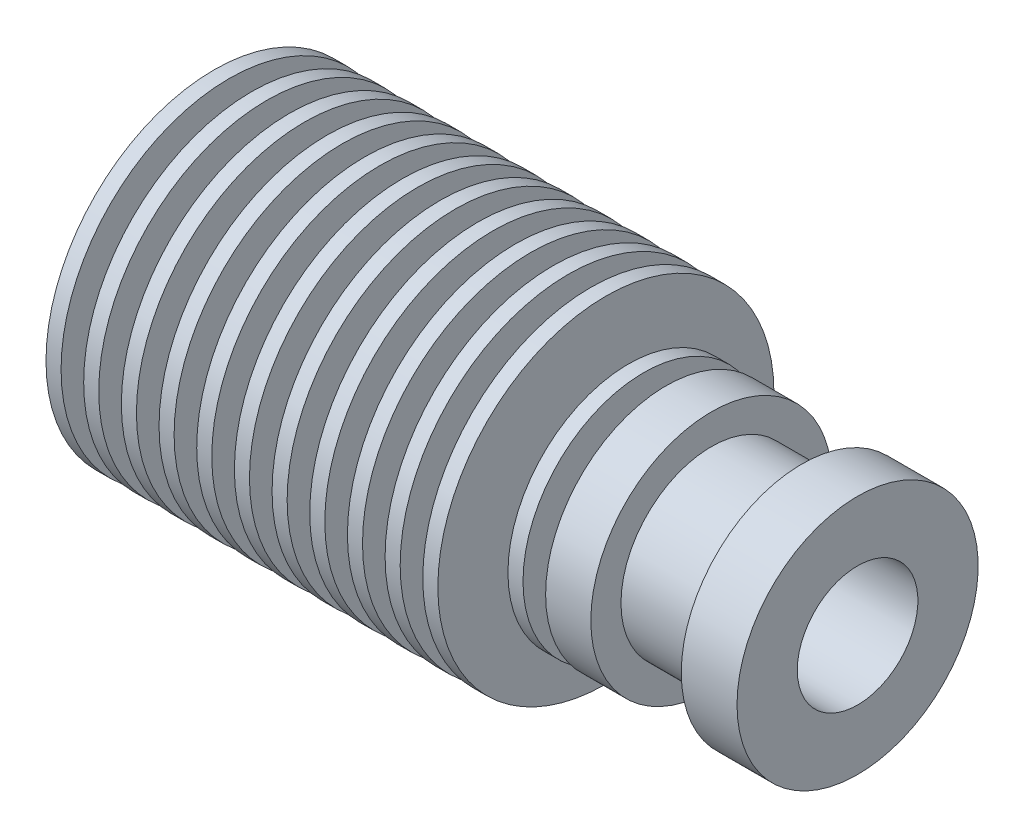
from build123d import *

# Parameters (mm, degrees)
THREAD1_PITCH = 1


with BuildPart() as part:
    # Sketch1 → Revolve1 (revolve)
    with BuildSketch(Plane.XY, mode=Mode.PRIVATE) as revolve1_sk:
        Polygon((9.7, 11.534202282), (6, 11.534202282), (6, 13.534202282), (0, 13.534202282), (0, 11.534202282), (-3, 11.534202282), (-3, 15.534202282), (-4.5, 15.457827897), (-4.5, 11.534202282), (-5.5, 11.534202282), (-5.5, 15.406911641), (-7, 15.330537257), (-7, 8.384202282), (-8, 8.384202282), (-8, 15.279621001), (-9.5, 15.203246617), (-9.5, 8.384202282), (-10.5, 8.384202282), (-10.5, 15.15233036), (-12, 15.075955976), (-12, 8.384202282), (-13, 8.384202282), (-13, 15.02503972), (-14.5, 14.948665336), (-14.5, 8.384202282), (-15.5, 8.384202282), (-15.5, 14.89774908), (-17, 14.821374695), (-17, 8.384202282), (-18, 8.384202282), (-18, 14.770458439), (-19.5, 14.694084055), (-19.5, 8.384202282), (-20.5, 8.384202282), (-20.5, 14.643167799), (-22, 14.566793415), (-22, 8.384202282), (-23, 8.384202282), (-23, 14.515877158), (-24.5, 14.439502774), (-24.5, 8.384202282), (-25.5, 8.384202282), (-25.5, 14.388586518), (-27, 14.312212134), (-27, 8.384202282), (-28, 8.384202282), (-28, 14.261295878), (-29.5, 14.184921493), (-29.5, 8.384202282), (-30.5, 8.384202282), (-30.5, 14.134005237), (-32, 14.057630853), (-32, 8.384202282), (-33, 8.384202282), (-33, 14.014202282), (-33, 16.534202282), (-17.9, 16.534202282), (-17, 17.434202282), (1.3, 17.434202282), (3.2, 15.534202282), (9.7, 15.534202282), align=None)
    revolve(revolve1_sk.sketch.rotate(Axis((-33, 19.534202282, 0), (1, 0, 0)), 270), axis=Axis((-33, 19.534202282, 0), (1, 0, 0)))

    # Thread1: the profile of Thread Profile2 profile screwed along a right-hand helix of 15.1 turns, 8 arcs to a turn; built about Z, then put on its axis
    thread1_z = Axis((0, 0, 0), (0, 0, 1))
    thread1_corners = [(2.9997, 0, -0.000173205), (3.541265875, 0, 0.312499999), (3.541265875, 0, 0.437499999), (2.9997, 0, 0.750173202)]
    with BuildLine(mode=Mode.PRIVATE) as thread1_profile:
        Line(thread1_corners[0], thread1_corners[1])
        Line(thread1_corners[1], thread1_corners[2])
        Line(thread1_corners[2], thread1_corners[3])
        Line(thread1_corners[3], thread1_corners[0])
    thread1_cap = Face(thread1_profile.wire())
    thread1_turn_angles = [0, 22.5, 45, 67.5, 90, 112.5, 135, 157.5, 180, 202.5, 225, 247.5, 270, 292.5, 315, 337.5, 360]
    thread1_turn_weights = [1, 0.9238795325112867, 1, 0.9238795325112867, 1, 0.9238795325112867, 1, 0.9238795325112867, 1, 0.9238795325112867, 1, 0.9238795325112867, 1, 0.9238795325112867, 1, 0.9238795325112867, 1]
    thread1_turn_rails = [Edge.make_bspline([Vector(p[0], p[1], 0).rotate(thread1_z, thread1_turn_angles[k]) / thread1_turn_weights[k] + Vector(0, 0, p[2] + THREAD1_PITCH * thread1_turn_angles[k] / 360) for k in range(17)], [0, 0, 0, 1, 1, 2, 2, 3, 3, 4, 4, 5, 5, 6, 6, 7, 7, 8, 8, 8], 2, thread1_turn_weights) for p in thread1_corners]
    thread1_turn_sides = [Face.make_surface_from_curves(thread1_turn_rails[p[0]], thread1_turn_rails[p[1]]) for p in [(0, 1), (1, 2), (2, 3), (3, 0)]]
    thread1_last_angles = [5400, 5418, 5436]
    thread1_last_weights = [1, 0.9510565162951535, 1]
    thread1_last_rails = [Edge.make_bspline([Vector(p[0], p[1], 0).rotate(thread1_z, thread1_last_angles[k]) / thread1_last_weights[k] + Vector(0, 0, p[2] + THREAD1_PITCH * thread1_last_angles[k] / 360) for k in range(3)], [0, 0, 0, 1, 1, 1], 2, thread1_last_weights) for p in thread1_corners]
    thread1_last_sides = [Face.make_surface_from_curves(thread1_last_rails[p[0]], thread1_last_rails[p[1]]) for p in [(0, 1), (1, 2), (2, 3), (3, 0)]]
    thread1 = Plane(origin=(-17.9, 19.534202282, 0), x_dir=(0, 0, 1), z_dir=(-1, 0, 0)) * Solid(Shell([*[p.moved(Location((0, 0, THREAD1_PITCH * i))) for i in range(15) for p in thread1_turn_sides], *thread1_last_sides, thread1_cap, thread1_cap.rotate(thread1_z, 5436).moved(Location((0, 0, THREAD1_PITCH * 5436 / 360)))]))
    add(thread1, mode=Mode.SUBTRACT)


solid = part.part
